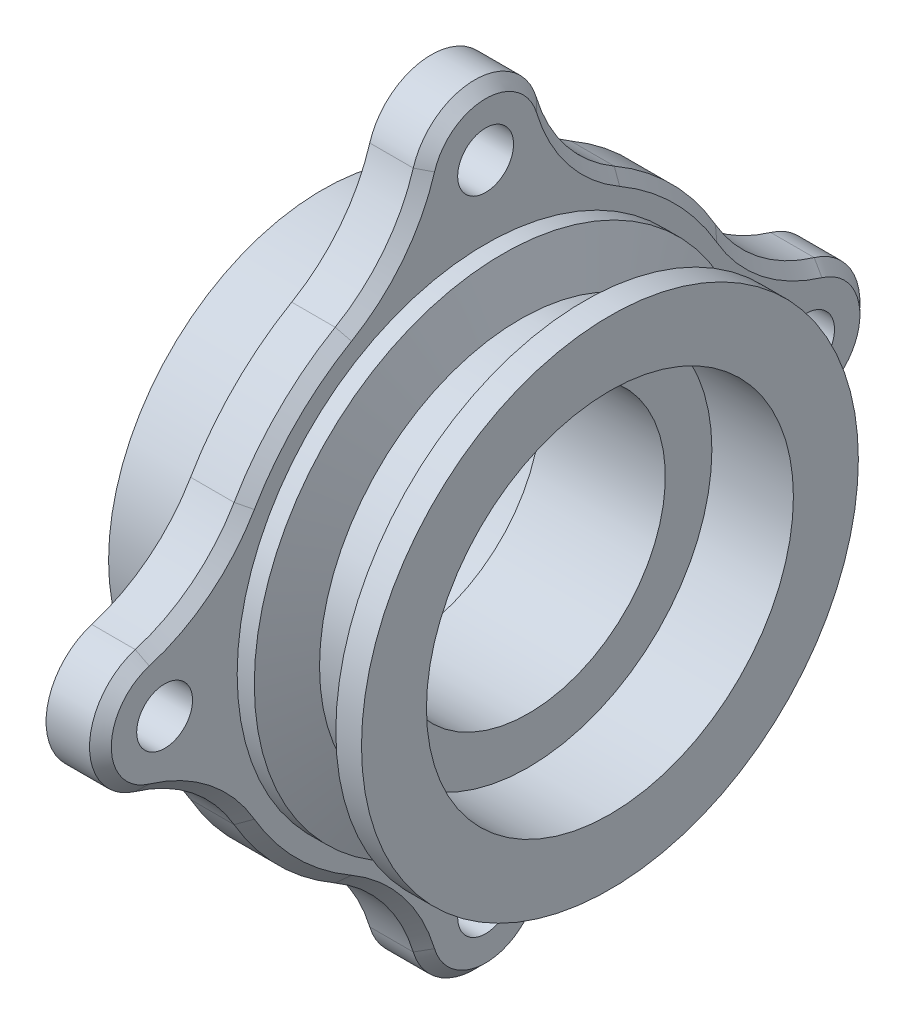
from build123d import *

# Parameters (mm, degrees)
F_5_16_18_TAPPED_HOLE1_D     = 6.5278
F_5_16_18_TAPPED_HOLE1_DEPTH = 54.11
F_5_16_18_TAPPED_HOLE1_TIP   = 1.961148974
CUT_EXTRUDE1_DEPTH           = 67.429680866
FILLET1_R                    = 20
CHAMFER1_SIZE                = 1.27


with BuildPart() as part:
    # Sketch1 → Revolve1 (revolve)
    with BuildSketch(Plane.XY):
        Polygon((-12.7, 25), (0, 25), (0, 45), (6.35, 45), (6.35, 29.0256), (8.35, 29.0256), (10.383865669, 23.4376), (15.841134331, 23.4376), (17.875, 29.0256), (20.875, 29.0256), (20.875, 21.4376), (11.35, 21.4376), (11.35, 16), (-3.175, 16), (-3.175, 21.4376), (-12.7, 21.4376), align=None)
    revolve(axis=Axis((0, 0, 0), (1, 0, 0)))

    # 5/16-18 Tapped Hole1
    with Locations(Plane.ZY):
        with Locations((-37.5, 0), (0, 37.5), (37.5, 0), (0, -37.5)):
            Hole(F_5_16_18_TAPPED_HOLE1_D / 2, depth=F_5_16_18_TAPPED_HOLE1_DEPTH)
            with Locations((0, 0, -(F_5_16_18_TAPPED_HOLE1_DEPTH + F_5_16_18_TAPPED_HOLE1_TIP / 2))):  # 118° drill point
                Cone(0, F_5_16_18_TAPPED_HOLE1_D / 2, F_5_16_18_TAPPED_HOLE1_TIP, mode=Mode.SUBTRACT)

    # Sketch5 → Cut-Extrude1 (cut, through all)
    with BuildSketch(Plane(origin=(6.35, 0, 0), x_dir=(0, 0, -1), z_dir=(1, 0, 0))):
        with BuildLine():
            ThreePointArc((2.6e-08, 45), (6.959705458, 40.29508496), (5.187458166, 32.083333333))
            ThreePointArc((5.187458166, 32.083333333), (22.980970389, 22.980970389), (32.083333333, 5.187458166))
            ThreePointArc((32.083333333, 5.187458166), (40.295084972, 6.959705454), (45, 0))
            ThreePointArc((45, 0), (31.819805163, 31.819805144), (2.6e-08, 45))
        make_face()
        with BuildLine():
            ThreePointArc((-5.187458166, 32.083333333), (-6.959705449, 40.295084984), (2.6e-08, 45))
            ThreePointArc((2.6e-08, 45), (-31.819805139, 31.819805168), (-45, 1.5e-08))
            ThreePointArc((-45, 1.5e-08), (-40.295084965, 6.959705456), (-32.083333333, 5.187458166))
            ThreePointArc((-32.083333333, 5.187458166), (-22.980970389, 22.980970389), (-5.187458166, 32.083333333))
        make_face()
        with BuildLine():
            ThreePointArc((0, -45), (31.819805153, -31.819805153), (45, 0))
            ThreePointArc((45, 0), (40.295084972, -6.959705454), (32.083333333, -5.187458166))
            ThreePointArc((32.083333333, -5.187458166), (22.980970389, -22.980970389), (5.187458166, -32.083333333))
            ThreePointArc((5.187458166, -32.083333333), (6.959705454, -40.295084972), (0, -45))
        make_face()
        with BuildLine():
            ThreePointArc((-32.083333333, -5.187458166), (-40.295084979, -6.959705451), (-45, 1.5e-08))
            ThreePointArc((-45, 1.5e-08), (-31.819805159, -31.819805148), (0, -45))
            ThreePointArc((0, -45), (-6.959705454, -40.295084972), (-5.187458166, -32.083333333))
            ThreePointArc((-5.187458166, -32.083333333), (-22.980970389, -22.980970389), (-32.083333333, -5.187458166))
        make_face()
    extrude(amount=-CUT_EXTRUDE1_DEPTH, mode=Mode.SUBTRACT)

    # Fillet1
    fillet1_edges = [part.edges().sort_by_distance(p)[0] for p in [
        (3.175, 5.187458166, 32.083333333),
        (3.175, -5.187458166, 32.083333333),
        (3.175, -32.083333333, 5.187458166),
        (3.175, -32.083333333, -5.187458166),
        (3.175, -5.187458166, -32.083333333),
        (3.175, 5.187458166, -32.083333333),
        (3.175, 32.083333333, -5.187458166),
        (3.175, 32.083333333, 5.187458166),
    ]]
    fillet(fillet1_edges, radius=FILLET1_R)

    # Chamfer1
    chamfer1_edges = [part.edges().sort_by_distance(p)[0] for p in [
        (6.35, -33.017966988, 10.642774853),
        (6.35, -45, 0),
        (6.35, -22.980970389, 22.980970389),
        (6.35, -33.017966988, -10.642774853),
        (6.35, -10.642774853, 33.017966988),
        (6.35, -22.980970389, -22.980970389),
        (6.35, 0, 45),
        (6.35, -10.642774853, -33.017966988),
        (6.35, 10.642774853, 33.017966988),
        (6.35, 0, -45),
        (6.35, 22.980970389, 22.980970389),
        (6.35, 10.642774853, -33.017966988),
        (6.35, 33.017966988, 10.642774853),
        (6.35, 22.980970389, -22.980970389),
        (6.35, 45, 0),
        (6.35, 33.017966988, -10.642774853),
    ]]
    chamfer(chamfer1_edges, length=CHAMFER1_SIZE)


solid = part.part
